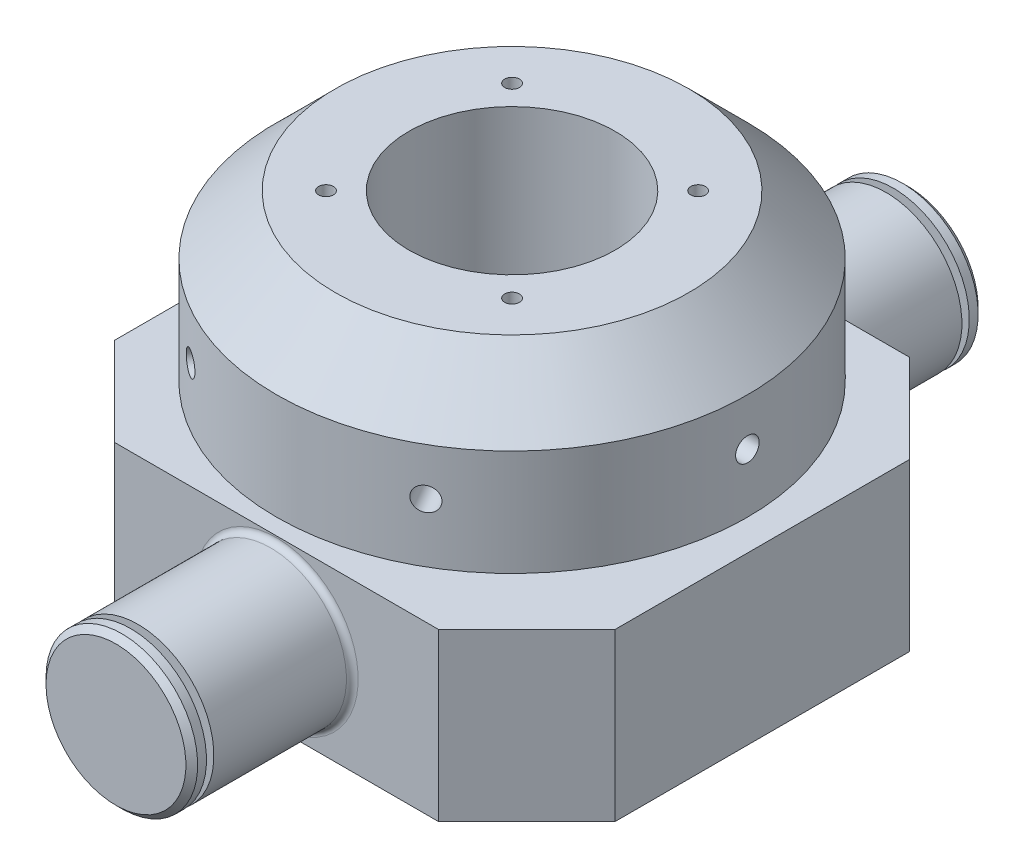
from build123d import *

# Parameters (mm, degrees)
MAIN_DEPTH                = 113
PERNO1_START              = 160
PERNO1_OUTLINE_R          = 51.5
PERNO1_DEPTH              = 94
PERNO1_2_OUTLINE_R        = 70
PERNO1_2_DEPTH            = 113
SANALATURAPERNO_START     = 254
SKETCH4_3_R               = 40
SANALATURAPERNO_DEPTH     = 5
PERNO2_START              = 259
SKETCH4_4_R               = 51.5
SKETCH4_4_R_2             = 40
PERNO2_DEPTH              = 10
CHAMFER1_SIZE             = 4
FILLET2_R                 = 4
CHAMFER1_OF_MIRROR14_SIZE = 4
FILLET2_OF_MIRROR14_R     = 4
CHAMFER2_SIZE             = 5
PISTA_R                   = 17
CIRPATTERN5_COUNT         = 22
CHAMFER3_SIZE             = 40
CIRPATTERN6_COUNT         = 6
CIRPATTERN7_COUNT         = 4


# Read off the part's stored shape, not the designer's step: Perno1
with BuildPart() as part:
    # MainBody → Main (new body)
    with BuildSketch(Plane(origin=(0, 0, 0), x_dir=(1, 0, 0), z_dir=(0, 1, 0))):
        Polygon((-110, 160), (110, 160), (170, 100), (170, -100), (110, -160), (-110, -160), (-170, -100), (-170, 100), align=None)
    extrude(amount=MAIN_DEPTH)

    # Perno1 outline → Perno1 (add)
    with BuildSketch(Plane.XY.offset(PERNO1_START)):
        with Locations((0, 56.5)):
            Circle(PERNO1_OUTLINE_R)
    perno1 = extrude(amount=PERNO1_DEPTH)

    # Perno1 2 outline → Perno1 2 (cut)
    with BuildSketch(Plane(origin=(0, 0, 0), x_dir=(1, 0, 0), z_dir=(0, 1, 0))):
        Circle(PERNO1_2_OUTLINE_R)
    perno1_2 = extrude(amount=PERNO1_2_DEPTH, mode=Mode.SUBTRACT)

    # Sketch4<3> → SanalaturaPerno (add)
    with BuildSketch(Plane.XY.offset(SANALATURAPERNO_START)):
        with Locations(Location((0, 56.5, 0), (0, 0, 180))):
            Circle(SKETCH4_3_R)
    sanalaturaperno = extrude(amount=SANALATURAPERNO_DEPTH)

    # Sketch4<4> → Perno2 (add)
    # profile 1 of 2: a face of its own
    with BuildSketch(Plane.XY.offset(PERNO2_START)):
        with Locations(Location((0, 56.5, 0), (0, 0, 180))):
            Circle(SKETCH4_4_R)
        with Locations(Location((0, 56.5, 0), (0, 0, 180))):
            Circle(SKETCH4_4_R_2, mode=Mode.SUBTRACT)
    # profile 2 of 2: a face of its own
    with BuildSketch(Plane.XY.offset(PERNO2_START)):
        with Locations(Location((0, 56.5, 0), (0, 0, 180))):
            Circle(SKETCH4_4_R_2)
    perno2 = extrude(amount=PERNO2_DEPTH)

    # Chamfer1
    chamfer1_edges = [part.edges().sort_by_distance(p)[0] for p in [
        (51.5, 56.5, 269),
    ]]
    chamfer(chamfer1_edges, length=CHAMFER1_SIZE)

    # Fillet2
    fillet2_edges = [part.edges().sort_by_distance(p)[0] for p in [
        (-51.5, 56.5, 160),
    ]]
    fillet(fillet2_edges, radius=FILLET2_R)

    # Mirror14: Perno1, Perno1 2, SanalaturaPerno, Perno2 across plane
    add(perno1.mirror(Plane.XY))
    add(perno1_2.mirror(Plane.XY), mode=Mode.SUBTRACT)
    add(sanalaturaperno.mirror(Plane.XY))
    add(perno2.mirror(Plane.XY))

    # Chamfer1 of Mirror14
    chamfer1_of_mirror14_edges = [part.edges().sort_by_distance(p)[0] for p in [
        (51.5, 56.5, -269),
    ]]
    chamfer(chamfer1_of_mirror14_edges, length=CHAMFER1_OF_MIRROR14_SIZE)

    # Fillet2 of Mirror14
    fillet2_of_mirror14_edges = [part.edges().sort_by_distance(p)[0] for p in [
        (-51.5, 56.5, -160),
    ]]
    fillet(fillet2_of_mirror14_edges, radius=FILLET2_OF_MIRROR14_R)

    # Chamfer2
    chamfer2_edges = [part.edges().sort_by_distance(p)[0] for p in [
        (-70, 0, 0),
    ]]
    chamfer(chamfer2_edges, length=CHAMFER2_SIZE)

    # Pista → PistaCut (revolve, cut)
    with BuildSketch(Plane.XY, mode=Mode.PRIVATE) as pistacut_sk:
        with Locations((106, 121)):
            Circle(PISTA_R)
    revolve(pistacut_sk.sketch.rotate(Axis((0, 113, 0), (0, -1, 0)), 90), axis=Axis((0, 113, 0), (0, -1, 0)), mode=Mode.SUBTRACT)


with BuildPart() as body_2:
    # Pista<4> → Sfera (revolve)
    with BuildSketch(Plane.XY):
        with BuildLine():
            Line((106, 104), (106, 133))
            ThreePointArc((106, 133), (120.5, 118.5), (106, 104))
        make_face()
    revolve(axis=Axis((106, 207.756618998, 0), (0, -1, 0)))


with BuildPart() as cirpattern5_1:
    # CirPattern5: pattern copy
    add(body_2.part.rotate(Axis((0, 0, 0), (0, 1, 0)), 1 * 360 / CIRPATTERN5_COUNT))


with BuildPart() as cirpattern5_2:
    # CirPattern5: pattern copy
    add(body_2.part.rotate(Axis((0, 0, 0), (0, 1, 0)), 2 * 360 / CIRPATTERN5_COUNT))


with BuildPart() as cirpattern5_3:
    # CirPattern5: pattern copy
    add(body_2.part.rotate(Axis((0, 0, 0), (0, 1, 0)), 3 * 360 / CIRPATTERN5_COUNT))


with BuildPart() as cirpattern5_4:
    # CirPattern5: pattern copy
    add(body_2.part.rotate(Axis((0, 0, 0), (0, 1, 0)), 4 * 360 / CIRPATTERN5_COUNT))


with BuildPart() as cirpattern5_5:
    # CirPattern5: pattern copy
    add(body_2.part.rotate(Axis((0, 0, 0), (0, 1, 0)), 5 * 360 / CIRPATTERN5_COUNT))


with BuildPart() as cirpattern5_6:
    # CirPattern5: pattern copy
    add(body_2.part.rotate(Axis((0, 0, 0), (0, 1, 0)), 6 * 360 / CIRPATTERN5_COUNT))


with BuildPart() as cirpattern5_7:
    # CirPattern5: pattern copy
    add(body_2.part.rotate(Axis((0, 0, 0), (0, 1, 0)), 7 * 360 / CIRPATTERN5_COUNT))


with BuildPart() as cirpattern5_8:
    # CirPattern5: pattern copy
    add(body_2.part.rotate(Axis((0, 0, 0), (0, 1, 0)), 8 * 360 / CIRPATTERN5_COUNT))


with BuildPart() as cirpattern5_9:
    # CirPattern5: pattern copy
    add(body_2.part.rotate(Axis((0, 0, 0), (0, 1, 0)), 9 * 360 / CIRPATTERN5_COUNT))


with BuildPart() as cirpattern5_10:
    # CirPattern5: pattern copy
    add(body_2.part.rotate(Axis((0, 0, 0), (0, 1, 0)), 10 * 360 / CIRPATTERN5_COUNT))


with BuildPart() as cirpattern5_11:
    # CirPattern5: pattern copy
    add(body_2.part.rotate(Axis((0, 0, 0), (0, 1, 0)), 11 * 360 / CIRPATTERN5_COUNT))


with BuildPart() as cirpattern5_12:
    # CirPattern5: pattern copy
    add(body_2.part.rotate(Axis((0, 0, 0), (0, 1, 0)), 12 * 360 / CIRPATTERN5_COUNT))


with BuildPart() as cirpattern5_13:
    # CirPattern5: pattern copy
    add(body_2.part.rotate(Axis((0, 0, 0), (0, 1, 0)), 13 * 360 / CIRPATTERN5_COUNT))


with BuildPart() as cirpattern5_14:
    # CirPattern5: pattern copy
    add(body_2.part.rotate(Axis((0, 0, 0), (0, 1, 0)), 14 * 360 / CIRPATTERN5_COUNT))


with BuildPart() as cirpattern5_15:
    # CirPattern5: pattern copy
    add(body_2.part.rotate(Axis((0, 0, 0), (0, 1, 0)), 15 * 360 / CIRPATTERN5_COUNT))


with BuildPart() as cirpattern5_16:
    # CirPattern5: pattern copy
    add(body_2.part.rotate(Axis((0, 0, 0), (0, 1, 0)), 16 * 360 / CIRPATTERN5_COUNT))


with BuildPart() as cirpattern5_17:
    # CirPattern5: pattern copy
    add(body_2.part.rotate(Axis((0, 0, 0), (0, 1, 0)), 17 * 360 / CIRPATTERN5_COUNT))


with BuildPart() as cirpattern5_18:
    # CirPattern5: pattern copy
    add(body_2.part.rotate(Axis((0, 0, 0), (0, 1, 0)), 18 * 360 / CIRPATTERN5_COUNT))


with BuildPart() as cirpattern5_19:
    # CirPattern5: pattern copy
    add(body_2.part.rotate(Axis((0, 0, 0), (0, 1, 0)), 19 * 360 / CIRPATTERN5_COUNT))


with BuildPart() as cirpattern5_20:
    # CirPattern5: pattern copy
    add(body_2.part.rotate(Axis((0, 0, 0), (0, 1, 0)), 20 * 360 / CIRPATTERN5_COUNT))


with BuildPart() as cirpattern5_21:
    # CirPattern5: pattern copy
    add(body_2.part.rotate(Axis((0, 0, 0), (0, 1, 0)), 21 * 360 / CIRPATTERN5_COUNT))


with BuildPart() as body_24:
    # Sketch6 → Revolve7 (revolve)
    with BuildSketch(Plane(origin=(0, 0, 0), x_dir=(0, 0, -1), z_dir=(1, 0, 0)), mode=Mode.PRIVATE) as revolve7_sk:
        with BuildLine():
            Line((70, 124), (91, 124))
            ThreePointArc((91, 124), (106, 133), (121, 124))
            Line((121, 124), (160, 124))
            Line((160, 124), (160, 236))
            Line((160, 236), (70, 236))
            Line((70, 236), (70, 124))
        make_face()
    revolve(revolve7_sk.sketch.rotate(Axis((0, 113, 0), (0, -1, 0)), 180), axis=Axis((0, 113, 0), (0, -1, 0)))

    # Chamfer3
    chamfer3_edges = [body_24.edges().sort_by_distance(p)[0] for p in [
        (0, 236, -160),
    ]]
    chamfer(chamfer3_edges, length=CHAMFER3_SIZE)

    # Sketch7 → ForiAvvitamento (revolve, cut)
    with BuildSketch(Plane.XY, mode=Mode.PRIVATE) as foriavvitamento_sk:
        Polygon((-163.134253855, 172), (-163.134253855, 164), (-98.515451701, 164), (-103.134253855, 172), align=None)
    foriavvitamento = revolve(foriavvitamento_sk.sketch.rotate(Axis((-163.134253855, 164, 0), (1, 0, 0)), 90), axis=Axis((-163.134253855, 164, 0), (1, 0, 0)), mode=Mode.SUBTRACT)

    # CirPattern6: ForiAvvitamento ×6 about axis
    cirpattern6_axis = Axis((0, 113, 0), (0, -1, 0))
    for i in range(1, CIRPATTERN6_COUNT):
        add(foriavvitamento.rotate(cirpattern6_axis, i * 360 / CIRPATTERN6_COUNT), mode=Mode.SUBTRACT)


with BuildPart() as cut_revolve2_tool:
    # Sketch8 → Cut-Revolve2 (revolve)
    with BuildSketch(Plane(origin=(0, 0, 0), x_dir=(0, 0, -1), z_dir=(1, 0, 0))):
        Polygon((-136, 134), (-136, 124), (-136, 113), (-136, 103), (-130, 103), (-130, 113), (-130, 124), (-130, 134), align=None)
    revolve(axis=Axis((0, 113, 0), (0, -1, 0)))


with BuildPart() as part_1:
    add(part.part)

    # Cut-Revolve2: cut by cut_revolve2_tool
    add(cut_revolve2_tool.part, mode=Mode.SUBTRACT)


with BuildPart() as body_24_1:
    add(body_24.part)

    # Cut-Revolve2: cut by cut_revolve2_tool
    add(cut_revolve2_tool.part, mode=Mode.SUBTRACT)

    # ForoPiastrina → Cut-Revolve3 (revolve, cut)
    with BuildSketch(Plane(origin=(0, 0, 0), x_dir=(-0.7071067811865273, 0, -0.7071067811865679), z_dir=(0.7071067811865679, 0, -0.7071067811865273)), mode=Mode.PRIVATE) as cut_revolve3_sk:
        Polygon((89.349774909, 236), (84.349774909, 236), (84.349774909, 216), (89.349774909, 213.113248654), (89.349774909, 216), align=None)
    cut_revolve3 = revolve(cut_revolve3_sk.sketch.rotate(Axis((-63.179831736, 216, -63.179831736), (0, 1, 0)), 135), axis=Axis((-63.179831736, 216, -63.179831736), (0, 1, 0)), mode=Mode.SUBTRACT)

    # CirPattern7: Cut-Revolve3 ×4 about axis
    cirpattern7_axis = Axis((0, 0, 0), (0, 1, 0))
    for i in range(1, CIRPATTERN7_COUNT):
        add(cut_revolve3.rotate(cirpattern7_axis, i * 360 / CIRPATTERN7_COUNT), mode=Mode.SUBTRACT)


solid = Compound([body_2.part, cirpattern5_1.part, cirpattern5_2.part, cirpattern5_3.part, cirpattern5_4.part, cirpattern5_5.part, cirpattern5_6.part, cirpattern5_7.part, cirpattern5_8.part, cirpattern5_9.part, cirpattern5_10.part, cirpattern5_11.part, cirpattern5_12.part, cirpattern5_13.part, cirpattern5_14.part, cirpattern5_15.part, cirpattern5_16.part, cirpattern5_17.part, cirpattern5_18.part, cirpattern5_19.part, cirpattern5_20.part, cirpattern5_21.part, part_1.part, body_24_1.part])
